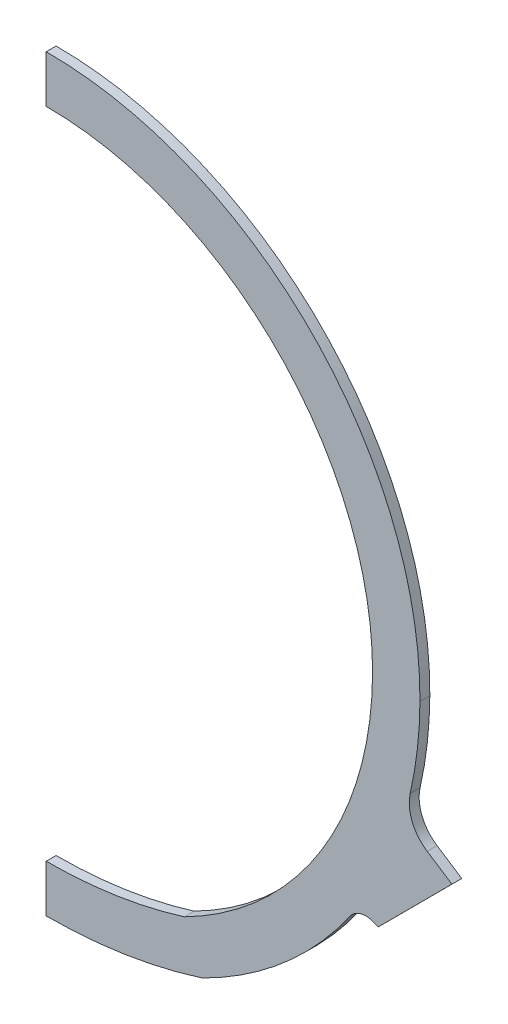
from build123d import *

# Parameters (mm, degrees)
BOSS_EXTRUDE1_DEPTH = 1.5875
SKETCH3_W           = 208.645691316
SKETCH3_H           = 383.026987577
CUT_EXTRUDE1_DEPTH  = 184.927178997
BOSS_EXTRUDE2_DEPTH = 1.5875
FILLET1_R           = 6.35
FILLET2_R           = 12.7


with BuildPart() as part:
    # Sketch2 → Boss-Extrude1 (new, symmetric)
    with BuildSketch(Plane.XY):
        with BuildLine():
            ThreePointArc((-120.098895727, 19.05), (0.406748907, 139.2017743), (120.203613722, 18.343301545))
            ThreePointArc((120.203613722, 18.343301545), (101.067699546, -47.629728931), (50.138751442, -93.726))
            ThreePointArc((50.138751442, -93.726), (0.040174098, -101.514794876), (-50.058403246, -93.726))
            ThreePointArc((-50.058403246, -93.726), (-101.163912713, -47.327889321), (-120.098895727, 19.05))
        make_face()
        with BuildLine():
            ThreePointArc((-104.858895727, 19.05), (0.361930242, 123.961840203), (104.963877332, 18.432938489))
            ThreePointArc((104.963877332, 18.432938489), (88.446745877, -39.065849025), (44.40486057, -79.553359885))
            ThreePointArc((44.40486057, -79.553359885), (0.040463589, -86.274794876), (-44.323959374, -79.553531384))
            ThreePointArc((-44.323959374, -79.553531384), (-88.517658334, -38.801393502), (-104.858895727, 19.05))
        make_face(mode=Mode.SUBTRACT)
    extrude(amount=BOSS_EXTRUDE1_DEPTH, both=True)

    # Sketch3 → Cut-Extrude1 (cut, through all)
    with BuildSketch(Plane(origin=(0, 0, 0), x_dir=(0, 0, -1), z_dir=(1, 0, 0))):
        with Locations((4.266053154, 20.866300598)):
            Rectangle(SKETCH3_W, SKETCH3_H)
    extrude(amount=-CUT_EXTRUDE1_DEPTH, mode=Mode.SUBTRACT)

    # Sketch5 → Boss-Extrude2 (add, symmetric)
    with BuildSketch(Plane.XY):
        Polygon((106.737194565, -51.241853864), (130.490770684, -27.421601906), (114.843624891, -17.260226616), (100.526035652, -48.488399646), align=None)
    extrude(amount=BOSS_EXTRUDE2_DEPTH, both=True)

    # Fillet1
    fillet1_edges = [part.edges().sort_by_distance(p)[0] for p in [
        (100.526035652, -48.488399646, 0),
    ]]
    fillet(fillet1_edges, radius=FILLET1_R)

    # Fillet2
    fillet2_edges = [part.edges().sort_by_distance(p)[0] for p in [
        (114.843624891, -17.260226616, 0),
    ]]
    fillet(fillet2_edges, radius=FILLET2_R)


solid = part.part
